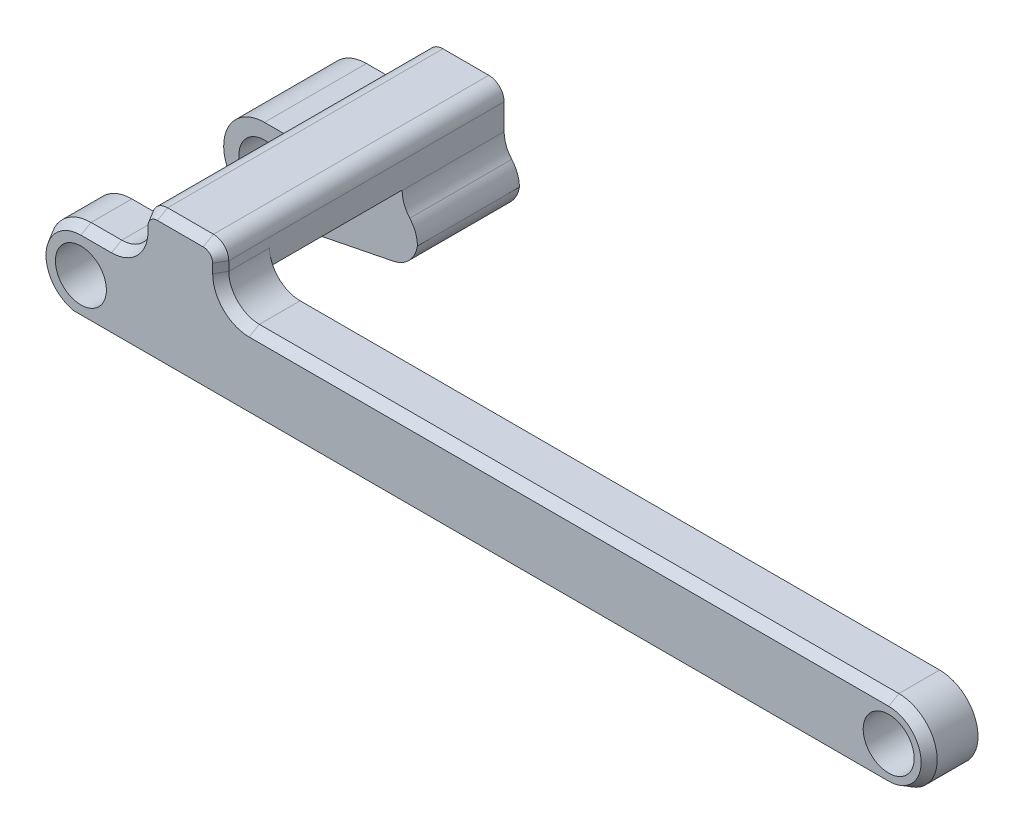
from build123d import *
from OCP.BRepFilletAPI import BRepFilletAPI_MakeChamfer

# Parameters (mm, degrees)
SKETCH1_R                       = 2.5
BOSS_EXTRUDE1_DEPTH             = 10
FILLET1_R                       = 3
CUT_EXTRUDE1_DEPTH              = 19.466185313
FILLET2_R                       = 3
FILLET3_R                       = 3
BOSS_EXTRUDE2_DEPTH             = 3
BOSS_EXTRUDE2_DEPTH_BACK        = 2
SKETCH3_W                       = 7.5
SKETCH3_H                       = 10
BOSS_EXTRUDE3_DEPTH             = 13
BOSS_EXTRUDE3_DIRECTION_2_REACH = 21.339
BOSS_EXTRUDE4_DEPTH             = 5
SKETCH6_R                       = 2.5
CUT_EXTRUDE2_DEPTH              = 87.565417468
FILLET5_R                       = 3
FILLET6_R                       = 1.5
CHAMFER1_SIZE                   = 1
CHAMFER1_SIZE2                  = 0.577350269


with BuildPart() as part:
    # Sketch1 → Boss-Extrude1 (new body)
    with BuildSketch(Plane.XY):
        with BuildLine():
            Line((0, 4), (15, 4))
            Line((15, 4), (15, -4))
            Line((15, -4), (0, -4))
            ThreePointArc((0, -4), (-4, 0), (0, 4))
        make_face()
        Circle(SKETCH1_R, mode=Mode.SUBTRACT)
    extrude(amount=BOSS_EXTRUDE1_DEPTH)

    # Fillet1
    fillet1_edges = [part.edges().sort_by_distance(p)[0] for p in [
        (15, 4, 5),
        (15, -4, 5),
    ]]
    fillet(fillet1_edges, radius=FILLET1_R)

    # Sketch2 → Cut-Extrude1 (cut, through all)
    with BuildSketch(Plane.XY.offset(10)):
        Polygon((15, -1), (0, -4), (15, -4), align=None)
    extrude(amount=-CUT_EXTRUDE1_DEPTH, mode=Mode.SUBTRACT)

    # Fillet2
    # the kernel refuses this fillet: 3 mm, written as the material it takes off along each edge
    with BuildSketch(Plane(origin=(15, -1, -6.055404624), x_dir=(-0.9805806756909201, -0.19611613513818393, 0), z_dir=(0, 0, 1))) as fillet2_piece_1:
        with BuildLine():
            CenterArc((2.42216185, -3), FILLET2_R, 90, 69.740076193)
            Line((-0.39223227, -1.961161351), (-0.448520153, -1.940384578))
            ThreePointArc((-0.448520153, -1.940384578), (-0.254950976, -0.968813708), (-0.058834841, 0.011766968))
            Line((-0.058834841, 0.011766968), (0, 0.06))
            Line((0, 0.06), (2.42216185, 0.06))
            Line((2.42216185, 0.06), (2.42216185, 0))
        make_face()
    extrude(amount=22.110809248, mode=Mode.SUBTRACT)

    # Fillet3
    fillet3_edges = [part.edges().sort_by_distance(p)[0] for p in [
        (0, -4, 5),
    ]]
    fillet(fillet3_edges, radius=FILLET3_R)

    # Sketch3 → Boss-Extrude2 (add, two sides: drawn at the far end of the back side and taken through both)
    with BuildSketch(Plane(origin=(0, 4, 0), x_dir=(1, 0, 0), z_dir=(0, 1, 0)).offset(-BOSS_EXTRUDE2_DEPTH_BACK)):
        with Locations((9.75, -5)):
            Rectangle(SKETCH3_W, SKETCH3_H)
    extrude(amount=BOSS_EXTRUDE2_DEPTH + BOSS_EXTRUDE2_DEPTH_BACK)

    # Sketch4 → Boss-Extrude3 (add)
    with BuildSketch(Plane.XY.offset(10)):
        Polygon((6, 7), (6, 9), (13.5, 9), (13.5, 7), (13.5, 5), (6, 5), align=None)
    extrude(amount=BOSS_EXTRUDE3_DEPTH)

    # Boss-Extrude3 direction 2: up to this face of the body (flat: up to its plane)
    boss_extrude3_direction_2_end = Plane(part.part.faces().sort_by_distance((6.608331714, 1.519169976, 0))[0])
    # Sketch4 → Boss-Extrude3 direction 2 (add, up to the picked face)
    with BuildSketch(Plane.XY.offset(10), mode=Mode.PRIVATE) as boss_extrude3_direction_2_sk1:
        Polygon((6, 7), (6, 9), (13.5, 9), (13.5, 7), (13.5, 5), (6, 5), align=None)
    boss_extrude3_direction_2_tool1 = split(extrude(boss_extrude3_direction_2_sk1.sketch, amount=-BOSS_EXTRUDE3_DIRECTION_2_REACH, mode=Mode.PRIVATE), bisect_by=boss_extrude3_direction_2_end, keep=Keep.BOTH, mode=Mode.PRIVATE)
    add(boss_extrude3_direction_2_tool1.solids().sort_by(Axis((9.75, 7, 10), (0, 0, -1)))[0])

    # Sketch5 → Boss-Extrude4 (add)
    with BuildSketch(Plane.XY.offset(23)):
        with BuildLine():
            Line((13.5, 3.598076211), (13.5, 5))
            Line((13.5, 5), (13.5, 9))
            Line((13.5, 9), (6, 9))
            Line((6, 9), (6, 5))
            Line((6, 5), (6, 4))
            Line((6, 4), (0, 4))
            ThreePointArc((0, 4), (-3.980145848, 0.398044003), (-0.792136593, -3.920780486))
            Line((-0.792136593, -3.920780486), (79.207863407, -3.920780486))
            ThreePointArc((79.207863407, -3.920780486), (82.967291756, -0.161352137), (79.207863407, 3.598076211))
            Line((79.207863407, 3.598076211), (13.5, 3.598076211))
        make_face()
    extrude(amount=BOSS_EXTRUDE4_DEPTH)

    # Sketch6 → Cut-Extrude2 (cut, through all)
    with BuildSketch(Plane(origin=(0, 0, 23), x_dir=(-1, 0, 0), z_dir=(0, 0, -1))):
        with Locations(Location((0, 0, 0), (0, 0, 180))):
            Circle(SKETCH6_R)
        with Locations((-79.207863407, -0.161352137)):
            Circle(SKETCH6_R)
    extrude(amount=-CUT_EXTRUDE2_DEPTH, mode=Mode.SUBTRACT)

    # Fillet5
    # the kernel refuses this fillet: 3 mm, written as the material it adds along each edge
    with BuildSketch(Plane(origin=(13.5, 3.598076211, 23), x_dir=(0, 1, 0), z_dir=(0, 0, 1))) as fillet5_piece_1:
        with BuildLine():
            CenterArc((FILLET5_R, -FILLET5_R), FILLET5_R, 90, 90)
            Line((0, -FILLET5_R), (0, 0))
            Line((0, 0), (FILLET5_R, 0))
        make_face()
    extrude(amount=5)
    with BuildSketch(Plane(origin=(6, 4, 15.5), x_dir=(0, 1, 0), z_dir=(0, 0, 1))) as fillet5_piece_2_section:
        with BuildLine():
            CenterArc((FILLET5_R, FILLET5_R), FILLET5_R, 180, 90)
            Line((0, FILLET5_R), (0, 0))
            Line((0, 0), (FILLET5_R, 0))
        make_face()
    fillet5_piece_2 = extrude(amount=12.5, mode=Mode.PRIVATE)
    fillet5_piece_2 = split(fillet5_piece_2, bisect_by=Plane(origin=(6, 5, 15.5), z_dir=(0, 1, 0)), keep=Keep.TOP, mode=Mode.PRIVATE)
    add(fillet5_piece_2)
    with BuildSketch(Plane(origin=(6, 4, 23), x_dir=(0, 1, 0), z_dir=(0, 0, 1))) as fillet5_piece_3:
        with BuildLine():
            CenterArc((FILLET5_R, FILLET5_R), FILLET5_R, 180, 90)
            Line((0, FILLET5_R), (0, 0))
            Line((0, 0), (FILLET5_R, 0))
        make_face()
    extrude(amount=5)
    with BuildSketch(Plane(origin=(13.5, 3.598076211, 0), x_dir=(0, 1, 0), z_dir=(0, 0, 1))) as fillet5_piece_4:
        with BuildLine():
            CenterArc((1.370550755, -3), FILLET5_R, 90, 41.409622109)
            ThreePointArc((-0.613762728, -0.75), (-0.276396038, -0.399947676), (0, 0))
            Line((0, 0), (1.370550755, 0))
        make_face()
    extrude(amount=10)
    with BuildSketch(Plane(origin=(6, 4, 0), x_dir=(-1, 0, 0), z_dir=(0, 0, 1))) as fillet5_piece_5:
        with BuildLine():
            CenterArc((FILLET5_R, -FILLET5_R), FILLET5_R, 90, 90)
            Line((0, -FILLET5_R), (0, 0))
            Line((0, 0), (FILLET5_R, 0))
        make_face()
    extrude(amount=10)
    with BuildSketch(Plane(origin=(6, 4, -7.5), x_dir=(-1, 0, 0), z_dir=(0, 0, 1))) as fillet5_piece_6_section:
        with BuildLine():
            CenterArc((FILLET5_R, -FILLET5_R), FILLET5_R, 90, 90)
            Line((0, -FILLET5_R), (0, 0))
            Line((0, 0), (FILLET5_R, 0))
        make_face()
    fillet5_piece_6 = extrude(amount=25, mode=Mode.PRIVATE)
    fillet5_piece_6 = split(fillet5_piece_6, bisect_by=Plane(origin=(6, 4, 10), z_dir=(0, 0, 1)), keep=Keep.TOP, mode=Mode.PRIVATE)
    fillet5_piece_6 = split(fillet5_piece_6, bisect_by=Plane(origin=(6, 5, -7.5), z_dir=(0, 1, 0)), keep=Keep.TOP, mode=Mode.PRIVATE)
    add(fillet5_piece_6)

    # Fillet6
    fillet6_edges = [part.edges().sort_by_distance(p)[0] for p in [
        (6, 9, 14),
        (13.5, 9, 14),
    ]]
    fillet(fillet6_edges, radius=FILLET6_R)

    # Chamfer1: one chamfer whose edges measure the first distance from different faces: ONE call of the kernel's chamfer builder (chamfer() names one face for all edges)
    chamfer1_edges_1 = [part.edges().sort_by_distance(p)[0] for p in [
        (47.853931704, 3.598076211, 28),
    ]]
    chamfer1_side_1 = [part.faces().sort_by_distance(p)[0] for p in [
        (47.853931704, 3.598076211, 25.5),
    ]]
    chamfer1_edges_2 = [part.edges().sort_by_distance(p)[0] for p in [
        (-3.980145848, 0.398044003, 28),
    ]]
    chamfer1_side_2 = [part.faces().sort_by_distance(p)[0] for p in [
        (-3.980145848, 0.398044003, 25.5),
    ]]
    chamfer1_edges_3 = [part.edges().sort_by_distance(p)[0] for p in [
        (39.207863407, -3.920780486, 28),
    ]]
    chamfer1_side_3 = [part.faces().sort_by_distance(p)[0] for p in [
        (39.207863407, -3.920780486, 25.5),
    ]]
    chamfer1_edges_4 = [part.edges().sort_by_distance(p)[0] for p in [
        (82.967291756, -0.161352137, 28),
    ]]
    chamfer1_side_4 = [part.faces().sort_by_distance(p)[0] for p in [
        (82.967291756, -0.161352137, 25.5),
    ]]
    chamfer1_edges_5 = [part.edges().sort_by_distance(p)[0] for p in [
        (13.5, 7.049038106, 28),
    ]]
    chamfer1_side_5 = [part.faces().sort_by_distance(p)[0] for p in [
        (13.5, 6.301445777, 12.480297412),
    ]]
    chamfer1_edges_6 = [part.edges().sort_by_distance(p)[0] for p in [
        (1.5, 4, 28),
    ]]
    chamfer1_side_6 = [part.faces().sort_by_distance(p)[0] for p in [
        (1.5, 4, 25.5),
    ]]
    chamfer1_edges_7 = [part.edges().sort_by_distance(p)[0] for p in [
        (14.378679656, 4.476755868, 28),
    ]]
    chamfer1_side_7 = [part.faces().sort_by_distance(p)[0] for p in [
        (14.378679656, 4.476755868, 25.5),
    ]]
    chamfer1_edges_8 = [part.edges().sort_by_distance(p)[0] for p in [
        (5.121320344, 4.878679656, 28),
    ]]
    chamfer1_side_8 = [part.faces().sort_by_distance(p)[0] for p in [
        (5.121320344, 4.878679656, 14),
    ]]
    chamfer1_edges_9 = [part.edges().sort_by_distance(p)[0] for p in [
        (9.75, 9, 28),
    ]]
    chamfer1_side_9 = [part.faces().sort_by_distance(p)[0] for p in [
        (9.75, 9, 14),
    ]]
    chamfer1_edges_10 = [part.edges().sort_by_distance(p)[0] for p in [
        (6, 7.25, 28),
    ]]
    chamfer1_side_10 = [part.faces().sort_by_distance(p)[0] for p in [
        (6, 7.25, 14),
    ]]
    chamfer1_edges_11 = [part.edges().sort_by_distance(p)[0] for p in [
        (13.060660172, 8.560660172, 28),
    ]]
    chamfer1_side_11 = [part.faces().sort_by_distance(p)[0] for p in [
        (13.060660172, 8.560660172, 14),
    ]]
    chamfer1_edges_12 = [part.edges().sort_by_distance(p)[0] for p in [
        (6.439339828, 8.560660172, 28),
    ]]
    chamfer1_side_12 = [part.faces().sort_by_distance(p)[0] for p in [
        (6.439339828, 8.560660172, 14),
    ]]
    chamfer1 = BRepFilletAPI_MakeChamfer(part.part.solid().wrapped)
    for e in chamfer1_edges_1:
        chamfer1.Add(CHAMFER1_SIZE, CHAMFER1_SIZE2, e.wrapped, chamfer1_side_1[0].wrapped)  # the first distance lies on this face
    for e in chamfer1_edges_2:
        chamfer1.Add(CHAMFER1_SIZE, CHAMFER1_SIZE2, e.wrapped, chamfer1_side_2[0].wrapped)  # the first distance lies on this face
    for e in chamfer1_edges_3:
        chamfer1.Add(CHAMFER1_SIZE, CHAMFER1_SIZE2, e.wrapped, chamfer1_side_3[0].wrapped)  # the first distance lies on this face
    for e in chamfer1_edges_4:
        chamfer1.Add(CHAMFER1_SIZE, CHAMFER1_SIZE2, e.wrapped, chamfer1_side_4[0].wrapped)  # the first distance lies on this face
    for e in chamfer1_edges_5:
        chamfer1.Add(CHAMFER1_SIZE, CHAMFER1_SIZE2, e.wrapped, chamfer1_side_5[0].wrapped)  # the first distance lies on this face
    for e in chamfer1_edges_6:
        chamfer1.Add(CHAMFER1_SIZE, CHAMFER1_SIZE2, e.wrapped, chamfer1_side_6[0].wrapped)  # the first distance lies on this face
    for e in chamfer1_edges_7:
        chamfer1.Add(CHAMFER1_SIZE, CHAMFER1_SIZE2, e.wrapped, chamfer1_side_7[0].wrapped)  # the first distance lies on this face
    for e in chamfer1_edges_8:
        chamfer1.Add(CHAMFER1_SIZE, CHAMFER1_SIZE2, e.wrapped, chamfer1_side_8[0].wrapped)  # the first distance lies on this face
    for e in chamfer1_edges_9:
        chamfer1.Add(CHAMFER1_SIZE, CHAMFER1_SIZE2, e.wrapped, chamfer1_side_9[0].wrapped)  # the first distance lies on this face
    for e in chamfer1_edges_10:
        chamfer1.Add(CHAMFER1_SIZE, CHAMFER1_SIZE2, e.wrapped, chamfer1_side_10[0].wrapped)  # the first distance lies on this face
    for e in chamfer1_edges_11:
        chamfer1.Add(CHAMFER1_SIZE, CHAMFER1_SIZE2, e.wrapped, chamfer1_side_11[0].wrapped)  # the first distance lies on this face
    for e in chamfer1_edges_12:
        chamfer1.Add(CHAMFER1_SIZE, CHAMFER1_SIZE2, e.wrapped, chamfer1_side_12[0].wrapped)  # the first distance lies on this face
    add(Compound.cast(chamfer1.Shape()), mode=Mode.REPLACE)


solid = part.part
